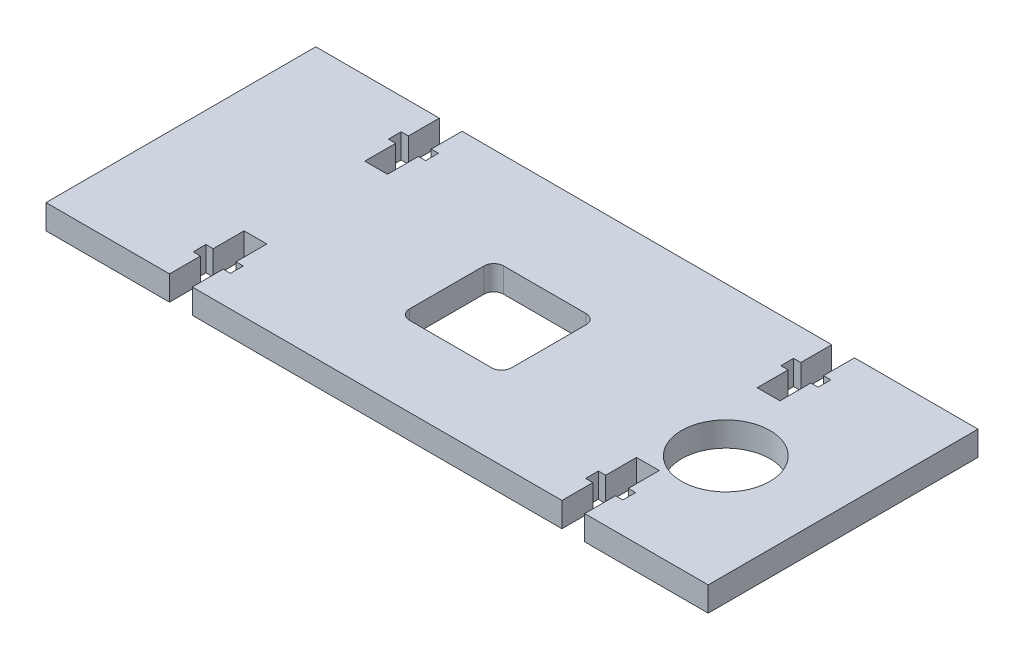
from build123d import *

# Parameters (mm, degrees)
SKETCH1_W           = 85.725
SKETCH1_H           = 34.925
BOSS_EXTRUDE1_DEPTH = 3.175
SKETCH2_R           = 5.715
SKETCH2_W           = 13.208
SKETCH2_H           = 12.192
CUT_EXTRUDE1_DEPTH  = 47.391954448
FILLET1_R           = 1.27
CUT_EXTRUDE2_DEPTH  = 47.391954448


with BuildPart() as part:
    # Sketch1 → Boss-Extrude1 (new body)
    with BuildSketch(Plane(origin=(0, 0, 0), x_dir=(1, 0, 0), z_dir=(0, 1, 0))):
        Rectangle(SKETCH1_W, SKETCH1_H)
    extrude(amount=BOSS_EXTRUDE1_DEPTH)

    # Sketch2 → Cut-Extrude1 (cut, through all)
    with BuildSketch(Plane(origin=(0, 0, 0), x_dir=(-1, 0, 0), z_dir=(0, -1, 0))):
        with Locations((-29.5375, -1.8635)):
            Circle(SKETCH2_R)
        with Locations((0.8075, -1.0435)):
            Rectangle(SKETCH2_W, SKETCH2_H)
    extrude(amount=-CUT_EXTRUDE1_DEPTH, mode=Mode.SUBTRACT)

    # Fillet1
    fillet1_edges = [part.edges().sort_by_distance(p)[0] for p in [
        (5.7965, 1.5875, -5.0525),
        (-7.4115, 1.5875, -5.0525),
        (5.7965, 1.5875, 7.1395),
        (-7.4115, 1.5875, 7.1395),
    ]]
    fillet(fillet1_edges, radius=FILLET1_R)

    # Sketch3 → Cut-Extrude2 (cut, through all)
    with BuildSketch(Plane.XZ):
        Polygon((-26.8732, 17.4625), (-23.9268, 17.4625), (-23.9268, 13.462), (-22.987, 13.462), (-22.987, 11.811), (-23.9268, 11.811), (-23.9268, 7.8105), (-26.8732, 7.8105), (-26.8732, 11.811), (-27.813, 11.811), (-27.813, 13.462), (-26.8732, 13.462), align=None)
        Polygon((26.8732, 11.811), (26.8732, 7.8105), (23.9268, 7.8105), (23.9268, 11.811), (22.987, 11.811), (22.987, 13.462), (23.9268, 13.462), (23.9268, 17.4625), (26.8732, 17.4625), (26.8732, 13.462), (27.813, 13.462), (27.813, 11.811), align=None)
        Polygon((26.8732, -17.4625), (23.9268, -17.4625), (23.9268, -13.462), (22.987, -13.462), (22.987, -11.811), (23.9268, -11.811), (23.9268, -7.8105), (26.8732, -7.8105), (26.8732, -11.811), (27.813, -11.811), (27.813, -13.462), (26.8732, -13.462), align=None)
        Polygon((-26.8732, -11.811), (-26.8732, -7.8105), (-23.9268, -7.8105), (-23.9268, -11.811), (-22.987, -11.811), (-22.987, -13.462), (-23.9268, -13.462), (-23.9268, -17.4625), (-26.8732, -17.4625), (-26.8732, -13.462), (-27.813, -13.462), (-27.813, -11.811), align=None)
    extrude(amount=-CUT_EXTRUDE2_DEPTH, mode=Mode.SUBTRACT)


solid = part.part
